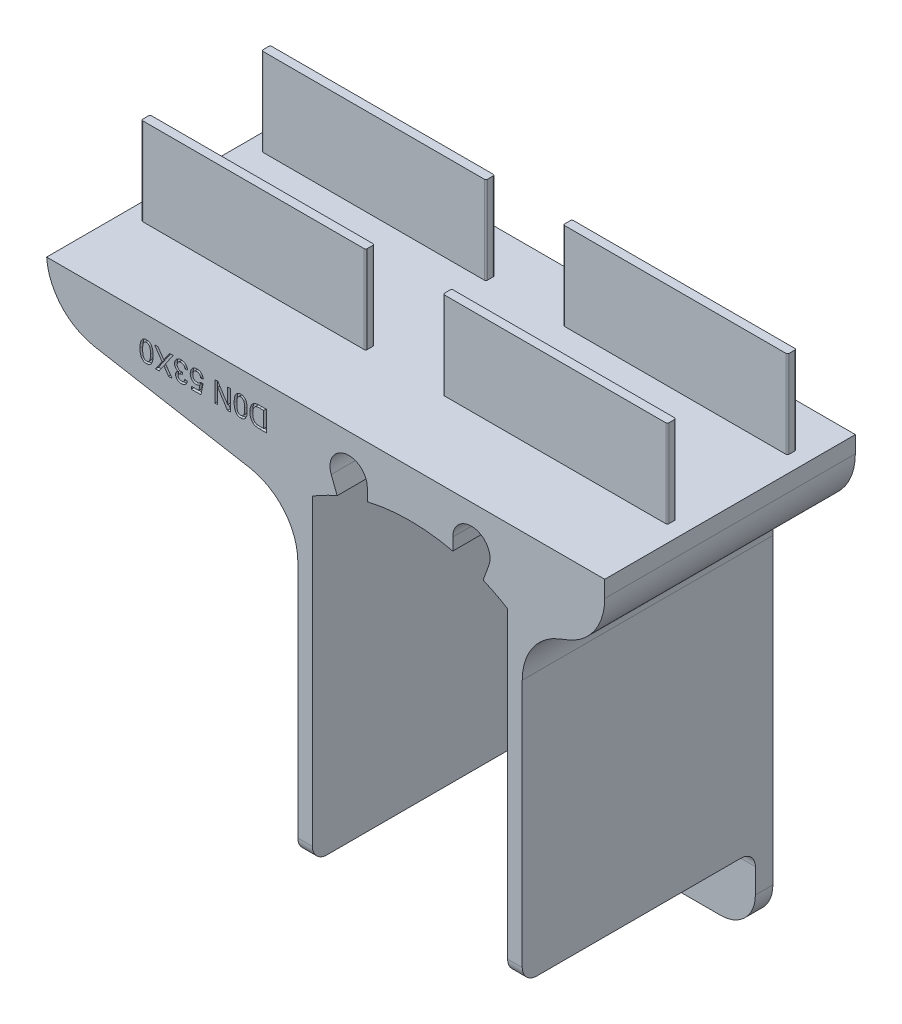
from build123d import *

# Parameters (mm, degrees)
SALIENTE_EXTRUIR1_DEPTH = 3
SALIENTE_EXTRUIR2_DEPTH = 40
SALIENTE_EXTRUIR3_START = -30.259494
SALIENTE_EXTRUIR3_DEPTH = 43
REDONDEO1_R             = 10
SALIENTE_EXTRUIR4_DEPTH = 15
CROQUIS12_R             = 1.6
CORTAR_EXTRUIR2_DEPTH   = 3
CORTAR_EXTRUIR3_START   = -3
CROQUIS13_R             = 3.2
CORTAR_EXTRUIR3_DEPTH   = 161.915601565
CORTAR_EXTRUIR4_START   = -40
CORTAR_EXTRUIR4_DEPTH   = 40
CROQUIS15_W             = 5
CROQUIS15_H             = 12.88583411
CORTAR_EXTRUIR5_DEPTH   = 10
REDONDEO2_R             = 2.5
REDONDEO2_R_2           = 1
CORTAR_EXTRUIR7_DEPTH   = 0.5


with BuildPart() as part:
    # Croquis4 → Saliente-Extruir1 (new body)
    with BuildSketch(Plane.XY):
        with BuildLine():
            Line((-61.92533433, -22.513800254), (-61.92533433, 45.486199746))
            ThreePointArc((-61.92533433, 45.486199746), (-63.682693643, 49.728840433), (-67.92533433, 51.486199746))
            Line((-67.92533433, 51.486199746), (-94.42533433, 51.486199746))
            ThreePointArc((-94.42533433, 51.486199746), (-98.667975017, 49.728840433), (-100.42533433, 45.486199746))
            Line((-100.42533433, 45.486199746), (-100.42533433, -22.513800254))
            ThreePointArc((-100.42533433, -22.513800254), (-98.667975017, -26.756440941), (-94.42533433, -28.513800254))
            Line((-94.42533433, -28.513800254), (-67.92533433, -28.513800254))
            ThreePointArc((-67.92533433, -28.513800254), (-63.682693643, -26.756440941), (-61.92533433, -22.513800254))
        make_face()
        with BuildLine():
            Line((-64.42533433, -15.795468477), (-64.42533433, 38.767867969))
            ThreePointArc((-64.42533433, 38.767867969), (-81.17533433, 43.486199746), (-97.92533433, 38.767867969))
            Line((-97.92533433, 38.767867969), (-97.92533433, -15.795468477))
            ThreePointArc((-97.92533433, -15.795468477), (-81.17533433, -20.513800254), (-64.42533433, -15.795468477))
        make_face(mode=Mode.SUBTRACT)
    extrude(amount=SALIENTE_EXTRUIR1_DEPTH)

    # Croquis5 → Saliente-Extruir2 (add)
    with BuildSketch(Plane.XY.offset(3)):
        with BuildLine():
            Line((-64.42533433, -15.795468477), (-64.42533433, 38.767867969))
            ThreePointArc((-64.42533433, 38.767867969), (-81.17533433, 43.486199746), (-97.92533433, 38.767867969))
            Line((-97.92533433, 38.767867969), (-97.92533433, -15.795468477))
            Line((-97.92533433, -15.795468477), (-100.42533433, -15.795468477))
            Line((-100.42533433, -15.795468477), (-100.42533433, 40.134829685))
            ThreePointArc((-100.42533433, 40.134829685), (-81.17533433, 45.986199746), (-61.92533433, 40.134829685))
            Line((-61.92533433, 40.134829685), (-61.92533433, -15.795468477))
            Line((-61.92533433, -15.795468477), (-64.42533433, -15.795468477))
        make_face()
    extrude(amount=SALIENTE_EXTRUIR2_DEPTH)

    # Croquis7 → Saliente-Extruir3 (add)
    with BuildSketch(Plane.XY.offset(30.259493934).offset(SALIENTE_EXTRUIR3_START)):
        with BuildLine():
            Line((-143.523202583, 51.486199746), (-143.523202583, 43.741183456))
            Line((-143.523202583, 43.741183456), (-100.42533433, 36.141866472))
            Line((-100.42533433, 36.141866472), (-100.42533433, 40.134829685))
            ThreePointArc((-100.42533433, 40.134829685), (-81.17533433, 45.986199746), (-61.92533433, 40.134829685))
            Line((-61.92533433, 40.134829685), (-61.92533433, 36.141866472))
            Line((-61.92533433, 36.141866472), (-47.771305799, 41.892946561))
            Line((-47.771305799, 41.892946561), (-47.771305799, 51.486199746))
            Line((-47.771305799, 51.486199746), (-143.523202583, 51.486199746))
        make_face()
    extrude(amount=SALIENTE_EXTRUIR3_DEPTH)

    # Redondeo1
    # the kernel refuses this fillet: 10 mm, written as the material it adds along each edge
    with BuildSketch(Plane(origin=(-61.92533433, 36.141866472, -6.6e-08), x_dir=(0, -1, 0), z_dir=(0, 0, 1))) as redondeo1_piece_1:
        with BuildLine():
            CenterArc((REDONDEO1_R * 0.673075430439, REDONDEO1_R), REDONDEO1_R, 202.112943676, 67.887056324)
            Line((-REDONDEO1_R * 0.253368184059, REDONDEO1_R * 0.623566434606), (0, 0))
            Line((0, 0), (REDONDEO1_R * 0.673075430439, 0))
        make_face()
    extrude(amount=43)
    with BuildSketch(Plane(origin=(-100.42533433, 36.141866472, -6.6e-08), x_dir=(0, -1, 0), z_dir=(0, 0, 1))) as redondeo1_piece_2:
        with BuildLine():
            CenterArc((REDONDEO1_R * 0.839099631177, -REDONDEO1_R), REDONDEO1_R, 90, 80)
            Line((-REDONDEO1_R * 0.145708121835, -REDONDEO1_R * 0.826351822333), (0, 0))
            Line((0, 0), (REDONDEO1_R * 0.839099631177, 0))
        make_face()
    extrude(amount=43)
    # the kernel refuses this fillet: 10 mm, written as the material it takes off along each edge
    with BuildSketch(Plane(origin=(-47.771305799, 41.892946561, -16.826885827), x_dir=(-0.9264436144982273, -0.3764335653942936, 0), z_dir=(0, 0, 1))) as redondeo1_2_piece_1:
        with BuildLine():
            CenterArc((REDONDEO1_R * 0.673075430439, -REDONDEO1_R), REDONDEO1_R, 90, 67.887056324)
            Line((-REDONDEO1_R * 0.253368184059, -REDONDEO1_R * 0.623566434606), (0, 0))
            Line((0, 0), (REDONDEO1_R * 0.673075430439, 0))
        make_face()
    extrude(amount=76.653771522, mode=Mode.SUBTRACT)
    with BuildSketch(Plane(origin=(-143.523202583, 43.741183456, -20.923855552), x_dir=(0, 1, 0), z_dir=(0, 0, 1))) as redondeo1_2_piece_2:
        with BuildLine():
            CenterArc((8.39472178, -9.978871819), REDONDEO1_R, 93.72516215, 76.27483785)
            Line((-1.45335575, -8.242390042), (0, 0))
            Line((0, 0), (7.74501629, 0))
        make_face()
    extrude(amount=84.847710972, mode=Mode.SUBTRACT)

    # Croquis8 → Saliente-Extruir4 (add)
    with BuildSketch(Plane(origin=(0, 51.486199746, 0), x_dir=(1, 0, 0), z_dir=(0, 1, 0))):
        with BuildLine():
            Line((-88.771305799, -7.384493934), (-50.771305799, -7.384493934))
            ThreePointArc((-50.771305799, -7.384493934), (-50.594529104, -7.457717239), (-50.521305799, -7.634493934))
            Line((-50.521305799, -7.634493934), (-50.521305799, -8.634493934))
            ThreePointArc((-50.521305799, -8.634493934), (-50.594529104, -8.811270629), (-50.771305799, -8.884493934))
            Line((-50.771305799, -8.884493934), (-88.771305799, -8.884493934))
            ThreePointArc((-88.771305799, -8.884493934), (-88.948082494, -8.811270629), (-89.021305799, -8.634493934))
            Line((-89.021305799, -8.634493934), (-89.021305799, -7.634493934))
            ThreePointArc((-89.021305799, -7.634493934), (-88.948082494, -7.457717239), (-88.771305799, -7.384493934))
        make_face()
        with BuildLine():
            Line((-88.771305799, -28.009493934), (-50.771305799, -28.009493934))
            ThreePointArc((-50.771305799, -28.009493934), (-50.594529104, -28.082717239), (-50.521305799, -28.259493934))
            Line((-50.521305799, -28.259493934), (-50.521305799, -29.259493934))
            ThreePointArc((-50.521305799, -29.259493934), (-50.594529104, -29.436270629), (-50.771305799, -29.509493934))
            Line((-50.771305799, -29.509493934), (-88.771305799, -29.509493934))
            ThreePointArc((-88.771305799, -29.509493934), (-88.948082494, -29.436270629), (-89.021305799, -29.259493934))
            Line((-89.021305799, -29.259493934), (-89.021305799, -28.259493934))
            ThreePointArc((-89.021305799, -28.259493934), (-88.948082494, -28.082717239), (-88.771305799, -28.009493934))
        make_face()
        with BuildLine():
            Line((-140.523202583, -28.009493934), (-102.523202583, -28.009493934))
            ThreePointArc((-102.523202583, -28.009493934), (-102.346425888, -28.082717239), (-102.273202583, -28.259493934))
            Line((-102.273202583, -28.259493934), (-102.273202583, -29.259493934))
            ThreePointArc((-102.273202583, -29.259493934), (-102.346425888, -29.436270629), (-102.523202583, -29.509493934))
            Line((-102.523202583, -29.509493934), (-140.523202583, -29.509493934))
            ThreePointArc((-140.523202583, -29.509493934), (-140.699979279, -29.436270629), (-140.773202583, -29.259493934))
            Line((-140.773202583, -29.259493934), (-140.773202583, -28.259493934))
            ThreePointArc((-140.773202583, -28.259493934), (-140.699979279, -28.082717239), (-140.523202583, -28.009493934))
        make_face()
        with BuildLine():
            Line((-140.523202583, -7.384493934), (-102.523202583, -7.384493934))
            ThreePointArc((-102.523202583, -7.384493934), (-102.346425888, -7.457717239), (-102.273202583, -7.634493934))
            Line((-102.273202583, -7.634493934), (-102.273202583, -8.634493934))
            ThreePointArc((-102.273202583, -8.634493934), (-102.346425888, -8.811270629), (-102.523202583, -8.884493934))
            Line((-102.523202583, -8.884493934), (-140.523202583, -8.884493934))
            ThreePointArc((-140.523202583, -8.884493934), (-140.699979279, -8.811270629), (-140.773202583, -8.634493934))
            Line((-140.773202583, -8.634493934), (-140.773202583, -7.634493934))
            ThreePointArc((-140.773202583, -7.634493934), (-140.699979279, -7.457717239), (-140.523202583, -7.384493934))
        make_face()
    extrude(amount=SALIENTE_EXTRUIR4_DEPTH)

    # Croquis12 → Cortar-Extruir2 (cut)
    with BuildSketch(Plane(origin=(0, 0, 0), x_dir=(-1, 0, 0), z_dir=(0, 0, -1))):
        with Locations((91.70533433, 44.736199746)):
            Circle(CROQUIS12_R)
        with Locations((70.64533433, 44.736199746)):
            Circle(CROQUIS12_R)
        with Locations((91.70533433, -21.763800254)):
            Circle(CROQUIS12_R)
        with Locations((70.64533433, -21.763800254)):
            Circle(CROQUIS12_R)
    extrude(amount=-CORTAR_EXTRUIR2_DEPTH, mode=Mode.SUBTRACT)

    # Croquis13 → Cortar-Extruir3 (cut, through all)
    with BuildSketch(Plane(origin=(0, 0, 0), x_dir=(-1, 0, 0), z_dir=(0, 0, -1)).offset(CORTAR_EXTRUIR3_START)):
        with Locations((70.64533433, 44.736199746)):
            Circle(CROQUIS13_R)
        with Locations((91.70533433, 44.736199746)):
            Circle(CROQUIS13_R)
    extrude(amount=-CORTAR_EXTRUIR3_DEPTH, mode=Mode.SUBTRACT)

    # Croquis14 → Cortar-Extruir4 (cut)
    with BuildSketch(Plane.XY.offset(43).offset(CORTAR_EXTRUIR4_START)):
        with BuildLine():
            Line((-94.696098231, 43.598073527), (-92.27582923, 37.238099531))
            Line((-92.27582923, 37.238099531), (-88.50533433, 37.238099531))
            Line((-88.50533433, 37.238099531), (-88.50533433, 44.736199746))
            ThreePointArc((-88.50533433, 44.736199746), (-92.283934156, 47.88345605), (-94.696098231, 43.598073527))
        make_face()
        with BuildLine():
            Line((-73.84533433, 44.736199746), (-73.84533433, 37.238099531))
            Line((-73.84533433, 37.238099531), (-69.986177524, 37.238099531))
            Line((-69.986177524, 37.238099531), (-67.6409103, 43.634638922))
            ThreePointArc((-67.6409103, 43.634638922), (-70.085940415, 47.8869264), (-73.84533433, 44.736199746))
        make_face()
    extrude(amount=CORTAR_EXTRUIR4_DEPTH, mode=Mode.SUBTRACT)

    # Croquis15 → Cortar-Extruir5 (cut)
    with BuildSketch(Plane.XY.offset(3)):
        with Locations((-81.17533433, -24.254653433)):
            Rectangle(CROQUIS15_W, CROQUIS15_H)
    extrude(amount=-CORTAR_EXTRUIR5_DEPTH, mode=Mode.SUBTRACT)

    # Redondeo2
    # the kernel refuses this fillet: 2.5, 1 mm, written as the material it adds along each edge
    with BuildSketch(Plane(origin=(-61.92533433, -15.795468477, 3), x_dir=(0, 0, 1), z_dir=(-1, 0, 0))) as redondeo2_piece_1_section:
        with BuildLine():
            CenterArc((REDONDEO2_R, -REDONDEO2_R), REDONDEO2_R, 90, 90)
            Line((0, -REDONDEO2_R), (0, 0))
            Line((0, 0), (REDONDEO2_R, 0))
        make_face()
    redondeo2_piece_1 = extrude(amount=2.5, mode=Mode.PRIVATE)
    redondeo2_piece_1 = redondeo2_piece_1 - Plane(origin=(-81.17533433, 11.576477524, 3), x_dir=(-0.5219649426531061, -0.8529669387737955, 0), z_dir=(0, 0, -1)) * Cylinder(32.090277778, 16, mode=Mode.PRIVATE)
    add(redondeo2_piece_1)
    with BuildSketch(Plane(origin=(-61.92533433, -15.795468477, 3), x_dir=(0, 0, 1), z_dir=(-1, 0, 0))) as redondeo2_piece_2_section:
        with BuildLine():
            CenterArc((REDONDEO2_R, -REDONDEO2_R), REDONDEO2_R, 90, 90)
            Line((0, -REDONDEO2_R), (0, 0))
            Line((0, 0), (REDONDEO2_R, 0))
        make_face()
    redondeo2_piece_2 = extrude(amount=8.75, mode=Mode.PRIVATE)
    redondeo2_piece_2 = split(redondeo2_piece_2, bisect_by=Plane(origin=(-64.42533433, -15.795468477, 3), z_dir=(-1, 0, 0)), keep=Keep.TOP, mode=Mode.PRIVATE)
    redondeo2_piece_2 = redondeo2_piece_2 - Plane(origin=(-81.17533433, 11.576477524, 3), x_dir=(-0.5219649426531061, -0.8529669387737955, 0), z_dir=(0, 0, -1)) * Cylinder(32.090277778, 28, mode=Mode.PRIVATE)
    add(redondeo2_piece_2)
    with BuildSketch(Plane(origin=(-91.67533433, -15.795468477, 3), x_dir=(0, -1, 0), z_dir=(-1, 0, 0))) as redondeo2_piece_3_section:
        with BuildLine():
            CenterArc((REDONDEO2_R, REDONDEO2_R), REDONDEO2_R, 180, 90)
            Line((0, REDONDEO2_R), (0, 0))
            Line((0, 0), (REDONDEO2_R, 0))
        make_face()
    redondeo2_piece_3 = extrude(amount=8.75, mode=Mode.PRIVATE)
    redondeo2_piece_3 = redondeo2_piece_3 - Plane(origin=(-81.17533433, 11.576477524, 3), x_dir=(-0.5219649426531061, -0.8529669387737955, 0), z_dir=(0, 0, -1)) * Cylinder(32.090277778, 28, mode=Mode.PRIVATE)
    redondeo2_piece_3 = split(redondeo2_piece_3, bisect_by=Plane(origin=(-97.92533433, -15.795468477, 3), z_dir=(1, 0, 0)), keep=Keep.TOP, mode=Mode.PRIVATE)
    add(redondeo2_piece_3)
    with BuildSketch(Plane(origin=(-97.92533433, -15.795468477, 3), x_dir=(0, -1, 0), z_dir=(-1, 0, 0))) as redondeo2_piece_4_section:
        with BuildLine():
            CenterArc((REDONDEO2_R, REDONDEO2_R), REDONDEO2_R, 180, 90)
            Line((0, REDONDEO2_R), (0, 0))
            Line((0, 0), (REDONDEO2_R, 0))
        make_face()
    redondeo2_piece_4 = extrude(amount=2.5, mode=Mode.PRIVATE)
    redondeo2_piece_4 = redondeo2_piece_4 - Plane(origin=(-81.17533433, 11.576477524, 3), x_dir=(-0.5219649426531061, -0.8529669387737955, 0), z_dir=(0, 0, -1)) * Cylinder(32.090277778, 15, mode=Mode.PRIVATE)
    add(redondeo2_piece_4)
    # the kernel refuses this fillet: 2.5, 1 mm, written as the material it takes off along each edge
    with BuildSketch(Plane(origin=(-83.67533433, -20.416270527, 5.279773555), x_dir=(-0.9957731104798505, 0.09184722339452334, 0), z_dir=(0, 0, -1))) as redondeo2_2_piece_1:
        with BuildLine():
            CenterArc((0.912016762, -0.999902105), REDONDEO2_R_2, 90.801717876, 83.928396695)
            Line((-0.083756348, -0.908054882), (0, 0))
            ThreePointArc((0, 0), (0.449012301, -0.00314148), (0.898024602, 0))
        make_face()
    extrude(amount=7.55954711, mode=Mode.SUBTRACT)
    with BuildSketch(Plane(origin=(-78.67533433, -20.416270527, 5.279773555), x_dir=(0.9957731104798505, 0.09184722339452334, 0), z_dir=(0, 0, -1))) as redondeo2_2_piece_2:
        with BuildLine():
            CenterArc((0.912016762, 0.999902105), REDONDEO2_R_2, 185.269885429, 83.928396695)
            Line((-0.083756348, 0.908054882), (0, 0))
            ThreePointArc((0, 0), (0.449012301, 0.00314148), (0.898024602, 0))
        make_face()
    extrude(amount=7.55954711, mode=Mode.SUBTRACT)
    with BuildSketch(Plane(origin=(-78.67533433, -28.513800254, -2.5), x_dir=(0, 1, 0), z_dir=(0, 0, 1)), Plane(origin=(-83.67533433, -28.513800254, 5.5), x_dir=(0, 1, 0), z_dir=(0, 0, -1))) as redondeo2_2_piece_3:
        with BuildLine():
            CenterArc((REDONDEO2_R_2, -REDONDEO2_R_2), REDONDEO2_R_2, 90, 90)
            Line((0, -REDONDEO2_R_2), (0, 0))
            Line((0, 0), (REDONDEO2_R_2, 0))
        make_face()
    extrude(amount=8, mode=Mode.SUBTRACT)
    with BuildSketch(Plane(origin=(-55.675334165, -15.795468477, 43), x_dir=(0, 0.9999999999999997, -2.646320069743527e-08), z_dir=(-1, 0, 0)), Plane(origin=(-91.675334165, -15.795468477, 43), x_dir=(1.4210854715201999e-15, 0.9999999999999997, -2.646320069743523e-08), z_dir=(-1, 0, 0))) as redondeo2_2_piece_4:
        with BuildLine():
            CenterArc((REDONDEO2_R * 1.00000002646, REDONDEO2_R), REDONDEO2_R, 179.999998484, 90)
            Line((REDONDEO2_R * 2.64631999767e-08, REDONDEO2_R * 1.00000002646), (0, 0))
            Line((0, 0), (REDONDEO2_R, 0))
        make_face()
    extrude(amount=15.000000331, mode=Mode.SUBTRACT)

    # Croquis18 → Cortar-Extruir7 (cut)
    # profile 1 of 7: a face of its own
    with BuildSketch(Plane.XY.offset(43)):
        with BuildLine():
            Line((-105.784803515, 47.713694789), (-105.784803515, 44.213694789))
            Line((-105.784803515, 44.213694789), (-106.981618419, 44.213694789))
            add(Edge.make_bspline(
                [(-106.981618419, 44.213694789), (-107.014341398, 44.213727734), (-107.077930846, 44.213791756), (-107.17022759, 44.217188253), (-107.25653495, 44.220013079), (-107.336679935, 44.226011278), (-107.411115983, 44.232491305), (-107.479488386, 44.242122645), (-107.542155858, 44.251118895), (-107.581355436, 44.259965881), (-107.600007842, 44.264175558)],
                knots=[0, 0, 0, 0, 1.263205393, 2.454743942, 3.565448358, 4.596561792, 5.557210882, 6.449177921, 7.26206951, 8, 8, 8, 8], degree=3))
            add(Edge.make_bspline(
                [(-107.600007842, 44.264175558), (-107.648298935, 44.276796855), (-107.742962558, 44.301538015), (-107.876555719, 44.358070089), (-107.999781716, 44.427647708), (-108.072785135, 44.48567346), (-108.109022265, 44.514476039)],
                knots=[0, 0, 0, 0, 1.044851836, 2.048192626, 3.031170054, 4, 4, 4, 4], degree=3))
            add(Edge.make_bspline(
                [(-108.109022265, 44.514476039), (-108.131534429, 44.534245268), (-108.176660659, 44.573873214), (-108.238639918, 44.639163834), (-108.296142433, 44.708423851), (-108.350859503, 44.780473683), (-108.399389282, 44.857891187), (-108.444634947, 44.938719297), (-108.485197748, 45.023792528), (-108.521792095, 45.112640446), (-108.552904392, 45.20563843), (-108.581287309, 45.301341755), (-108.604285594, 45.400674868), (-108.622946053, 45.503212076), (-108.638755231, 45.6088313), (-108.648899093, 45.717908421), (-108.65545056, 45.830166478), (-108.656212052, 45.906193196), (-108.656598387, 45.944764501)],
                knots=[0, 0, 0, 0, 0.908937239, 1.821988899, 2.72834861, 3.640518201, 4.565341062, 5.498854507, 6.450621543, 7.424027163, 8.413224035, 9.425546677, 10.452695354, 11.505842725, 12.58820393, 13.692765598, 14.829450422, 16, 16, 16, 16], degree=3))
            add(Edge.make_bspline(
                [(-108.656598387, 45.944764501), (-108.655653967, 46.009312481), (-108.653816147, 46.134921329), (-108.635803453, 46.317397559), (-108.607659327, 46.488873121), (-108.56694964, 46.648360355), (-108.516864298, 46.795584824), (-108.461391365, 46.930418556), (-108.398999789, 47.051865504), (-108.329860947, 47.159652428), (-108.255898082, 47.25560093), (-108.177944717, 47.340415395), (-108.097396377, 47.41553467), (-108.011700212, 47.479691625), (-107.920016633, 47.534890651), (-107.820654381, 47.582967933), (-107.711857742, 47.622360575), (-107.594655711, 47.656374475), (-107.467945471, 47.681771707), (-107.332649567, 47.70064332), (-107.188409771, 47.711979077), (-107.089378217, 47.713111804), (-107.038409284, 47.713694789)],
                knots=[0, 0, 0, 0, 1.410896996, 2.745572339, 4.004803626, 5.206943026, 6.339671611, 7.40250992, 8.392084316, 9.320508322, 10.198457542, 11.037492232, 11.836665538, 12.603135473, 13.373428224, 14.173319976, 15.012401344, 15.900286915, 16.839281235, 17.835076164, 18.88577074, 20, 20, 20, 20], degree=3))
            Line((-107.038409284, 47.713694789), (-105.784803515, 47.713694789))
        make_face()
        with BuildLine():
            Line((-106.278393259, 47.309848635), (-106.999847586, 47.309848635))
            add(Edge.make_bspline(
                [(-106.999847586, 47.309848635), (-107.052456733, 47.309070328), (-107.151981517, 47.307597945), (-107.292357447, 47.296041518), (-107.415059307, 47.276657682), (-107.520853505, 47.247443062), (-107.612663576, 47.211421084), (-107.693667809, 47.168771113), (-107.765953361, 47.120584751), (-107.806646166, 47.081428234), (-107.826470182, 47.062352642)],
                knots=[0, 0, 0, 0, 1.42394665, 2.693789808, 3.809767978, 4.781339506, 5.658909862, 6.473911632, 7.256546726, 8, 8, 8, 8], degree=3))
            add(Edge.make_bspline(
                [(-107.826470182, 47.062352642), (-107.852287638, 47.032827464), (-107.905325572, 46.972172594), (-107.971433502, 46.866234327), (-108.028942637, 46.746664833), (-108.077988834, 46.613199227), (-108.116446607, 46.465057237), (-108.143031465, 46.302180735), (-108.160161213, 46.124616552), (-108.162035864, 46.001130563), (-108.163008643, 45.937052161)],
                knots=[0, 0, 0, 0, 0.782156772, 1.606819028, 2.48344231, 3.428394571, 4.441474292, 5.534758072, 6.720755568, 8, 8, 8, 8], degree=3))
            add(Edge.make_bspline(
                [(-108.163008643, 45.937052161), (-108.162523179, 45.892397836), (-108.161579294, 45.805576735), (-108.152773799, 45.679272989), (-108.140010043, 45.560775515), (-108.121062086, 45.450252351), (-108.096902076, 45.347759215), (-108.066526738, 45.253432255), (-108.031776248, 45.16663326), (-107.99106909, 45.087924738), (-107.945450378, 45.017061708), (-107.898776242, 44.951698772), (-107.849677655, 44.892297093), (-107.797450248, 44.839721115), (-107.743609009, 44.792451859), (-107.687164257, 44.751448078), (-107.628270367, 44.716724676), (-107.586886131, 44.698699429), (-107.566353996, 44.689756488)],
                knots=[0, 0, 0, 0, 1.460175233, 2.839008838, 4.138850805, 5.35645207, 6.503979257, 7.579611513, 8.594434352, 9.558450226, 10.472350594, 11.34842506, 12.184161516, 12.989461046, 13.769593904, 14.524843114, 15.268124212, 16, 16, 16, 16], degree=3))
            add(Edge.make_bspline(
                [(-107.566353996, 44.689756488), (-107.550310994, 44.683885443), (-107.516316924, 44.671445084), (-107.460835306, 44.657364468), (-107.398917258, 44.644406401), (-107.329952478, 44.635311528), (-107.254289751, 44.626472303), (-107.171458762, 44.62110089), (-107.081893922, 44.618666706), (-107.019947662, 44.617924552), (-106.987928515, 44.617540943)],
                knots=[0, 0, 0, 0, 0.699400087, 1.48198292, 2.341906832, 3.289648813, 4.329964754, 5.462247508, 6.688271602, 8, 8, 8, 8], degree=3))
            Line((-106.987928515, 44.617540943), (-106.278393259, 44.617540943))
            Line((-106.278393259, 44.617540943), (-106.278393259, 47.309848635))
        make_face(mode=Mode.SUBTRACT)
    # profile 2 of 7: a face of its own
    with BuildSketch(Plane.XY.offset(43)):
        with BuildLine():
            add(Edge.make_bspline(
                [(-109.105316336, 45.98753293), (-109.105768542, 45.937514742), (-109.106654223, 45.839550173), (-109.112144613, 45.696210007), (-109.121739402, 45.560087282), (-109.136032, 45.431293459), (-109.153085573, 45.309333768), (-109.174931923, 45.194533232), (-109.19986217, 45.086762886), (-109.229412828, 44.986431754), (-109.262427474, 44.892498851), (-109.299256499, 44.804699821), (-109.34119582, 44.723483135), (-109.384704563, 44.646915351), (-109.434206704, 44.577934344), (-109.486225384, 44.514034652), (-109.542344607, 44.456326172), (-109.602805051, 44.405088048), (-109.667138018, 44.359852877), (-109.735140951, 44.320593525), (-109.807304072, 44.287153972), (-109.883830925, 44.260956326), (-109.963976632, 44.239870722), (-110.048058341, 44.224283448), (-110.136225951, 44.215112489), (-110.196473877, 44.214172695), (-110.227111208, 44.213694789)],
                knots=[0, 0, 0, 0, 1.514548985, 2.966363668, 4.342801279, 5.645536807, 6.88951609, 8.070636169, 9.18292944, 10.237633186, 11.23586543, 12.196673567, 13.117642805, 14.002448775, 14.860474521, 15.685016546, 16.495716207, 17.293997176, 18.081286888, 18.873901753, 19.668661895, 20.485546082, 21.319749152, 22.176139114, 23.072528574, 24, 24, 24, 24], degree=3))
            add(Edge.make_bspline(
                [(-110.227111208, 44.213694789), (-110.272066202, 44.21499561), (-110.360382091, 44.217551126), (-110.489160358, 44.239006405), (-110.610900055, 44.274133157), (-110.724678067, 44.32301782), (-110.828995887, 44.385641309), (-110.922547549, 44.460892633), (-111.00307354, 44.549893441), (-111.072164986, 44.65082528), (-111.13146323, 44.763657427), (-111.18449245, 44.887422241), (-111.232042629, 45.022616967), (-111.266846171, 45.143293998), (-111.291246787, 45.247642774), (-111.306102533, 45.333869476), (-111.319818702, 45.426622922), (-111.329540908, 45.526125254), (-111.339434043, 45.631911414), (-111.344318404, 45.744442679), (-111.348045892, 45.863642634), (-111.348613975, 45.945461983), (-111.348906079, 45.98753293)],
                knots=[0, 0, 0, 0, 1.134392726, 2.228560011, 3.285421824, 4.326686528, 5.345663051, 6.348245061, 7.346442277, 8.364444627, 9.428234171, 10.559369172, 11.76117748, 13.044149777, 13.72830454, 14.465558531, 15.252424724, 16.094928615, 16.989169351, 17.934396366, 18.93788079, 20, 20, 20, 20], degree=3))
            add(Edge.make_bspline(
                [(-111.348906079, 45.98753293), (-111.34844804, 46.037316585), (-111.34755317, 46.134578753), (-111.342173334, 46.276763896), (-111.332129614, 46.411879623), (-111.31919541, 46.540093047), (-111.30175098, 46.661514935), (-111.280091952, 46.775652664), (-111.25474915, 46.882778457), (-111.226252126, 46.983322655), (-111.193376587, 47.077506696), (-111.156125098, 47.165210823), (-111.115458045, 47.247114191), (-111.070681185, 47.322801172), (-111.022025831, 47.392521791), (-110.970277811, 47.456739968), (-110.913998353, 47.514562996), (-110.853301357, 47.565697442), (-110.789406567, 47.611767067), (-110.721030651, 47.651176676), (-110.648332397, 47.684054049), (-110.571960041, 47.711532622), (-110.491406574, 47.732415764), (-110.407091741, 47.747920942), (-110.318465461, 47.757182004), (-110.257982764, 47.75809869), (-110.227111208, 47.758566584)],
                knots=[0, 0, 0, 0, 1.508950488, 2.948031798, 4.311688408, 5.614950163, 6.853137481, 8.028455569, 9.134944892, 10.188708076, 11.194600246, 12.156350049, 13.075032267, 13.964295672, 14.819092354, 15.649926205, 16.461420415, 17.260483761, 18.05264124, 18.846032929, 19.648010917, 20.468054852, 21.303075505, 22.167271292, 23.064539283, 24, 24, 24, 24], degree=3))
            add(Edge.make_bspline(
                [(-110.227111208, 47.758566584), (-110.186635926, 47.757412025), (-110.107720268, 47.755160951), (-109.992469768, 47.739866295), (-109.884301027, 47.712946981), (-109.782301703, 47.676844385), (-109.687618295, 47.628555085), (-109.59979873, 47.569801721), (-109.517078335, 47.501951253), (-109.469459447, 47.448418792), (-109.445360406, 47.421327001)],
                knots=[0, 0, 0, 0, 1.10322584, 2.150986741, 3.161425019, 4.136713905, 5.093944212, 6.049774532, 7.013026876, 8, 8, 8, 8], degree=3))
            add(Edge.make_bspline(
                [(-109.445360406, 47.421327001), (-109.417621856, 47.381313735), (-109.360423778, 47.298804669), (-109.293478388, 47.158119057), (-109.233761914, 47.003243952), (-109.186895431, 46.831140721), (-109.150187292, 46.643179112), (-109.123674851, 46.438990304), (-109.108671419, 46.218662513), (-109.106459943, 46.066315329), (-109.105316336, 45.98753293)],
                knots=[0, 0, 0, 0, 0.779365345, 1.607084704, 2.489375761, 3.438383567, 4.461919411, 5.557722155, 6.737039282, 8, 8, 8, 8], degree=3))
        make_face()
        with BuildLine():
            add(Edge.make_bspline(
                [(-109.554034284, 45.986130687), (-109.554479826, 46.053448417), (-109.55533269, 46.182309443), (-109.564243054, 46.36640965), (-109.579581878, 46.532493168), (-109.599860806, 46.680330041), (-109.626637201, 46.810120249), (-109.660258132, 46.921533045), (-109.698156917, 47.015905638), (-109.745055946, 47.092068349), (-109.796405203, 47.15415207), (-109.849419802, 47.207546078), (-109.905346992, 47.252929762), (-109.963821856, 47.290770498), (-110.025751673, 47.319421018), (-110.090459251, 47.340186979), (-110.15795867, 47.35213747), (-110.203928841, 47.353854531), (-110.227111208, 47.35472043)],
                knots=[0, 0, 0, 0, 1.89448813, 3.626469325, 5.185477471, 6.587276848, 7.82441448, 8.910550357, 9.859733512, 10.6775885, 11.416198291, 12.123144072, 12.791880183, 13.439617036, 14.078171869, 14.70637855, 15.347637704, 16, 16, 16, 16], degree=3))
            add(Edge.make_bspline(
                [(-110.227111208, 47.35472043), (-110.250287957, 47.353835839), (-110.296246989, 47.352081712), (-110.36389963, 47.340391416), (-110.428365698, 47.318568872), (-110.490164399, 47.289972511), (-110.549338406, 47.253095667), (-110.604499271, 47.206708762), (-110.658108086, 47.153476857), (-110.708909847, 47.090684025), (-110.756118449, 47.014548367), (-110.793945639, 46.920115836), (-110.827596883, 46.808723659), (-110.854285708, 46.679149322), (-110.874708862, 46.531568463), (-110.889935822, 46.365938554), (-110.898911676, 46.182077378), (-110.8997496, 46.053448887), (-110.900188131, 45.986130687)],
                knots=[0, 0, 0, 0, 0.652578524, 1.294050225, 1.924494109, 2.563260593, 3.207694917, 3.880813851, 4.587993952, 5.331957758, 6.150083828, 7.099581593, 8.186077474, 9.42362516, 10.819375359, 12.378900244, 14.104883934, 16, 16, 16, 16], degree=3))
            add(Edge.make_bspline(
                [(-110.900188131, 45.986130687), (-110.899763208, 45.920213318), (-110.898949072, 45.793918133), (-110.889747659, 45.613364692), (-110.875328561, 45.450068586), (-110.855604464, 45.303880553), (-110.829394475, 45.174955234), (-110.797595254, 45.063030846), (-110.759732593, 44.968307017), (-110.714618959, 44.88995289), (-110.664598414, 44.825274148), (-110.611452864, 44.770380866), (-110.556210792, 44.722276042), (-110.49571534, 44.684608974), (-110.432538262, 44.653716544), (-110.365325242, 44.633036148), (-110.294944142, 44.619763628), (-110.246804923, 44.618292674), (-110.222203355, 44.617540943)],
                knots=[0, 0, 0, 0, 1.850145643, 3.544809038, 5.072983816, 6.450691362, 7.683229814, 8.76276662, 9.712991103, 10.538891656, 11.292051756, 12.001912283, 12.681449089, 13.342071824, 13.996410874, 14.649960216, 15.310061595, 16, 16, 16, 16], degree=3))
            add(Edge.make_bspline(
                [(-110.222203355, 44.617540943), (-110.199019459, 44.618143016), (-110.153303788, 44.619330228), (-110.086421522, 44.630872276), (-110.022749406, 44.649714227), (-109.96271118, 44.67689428), (-109.905712561, 44.710613806), (-109.851684386, 44.751626892), (-109.801922037, 44.801195624), (-109.771973617, 44.838333097), (-109.756658483, 44.857324597)],
                knots=[0, 0, 0, 0, 1.021462953, 2.014194051, 2.982449609, 3.941891643, 4.91211921, 5.897280499, 6.924703483, 8, 8, 8, 8], degree=3))
            add(Edge.make_bspline(
                [(-109.756658483, 44.857324597), (-109.739980272, 44.885207529), (-109.704759402, 44.94409041), (-109.665363976, 45.046434458), (-109.63042808, 45.163598217), (-109.602053237, 45.297026991), (-109.581057126, 45.446537538), (-109.564795755, 45.61189141), (-109.556266876, 45.793700551), (-109.554799014, 45.920217572), (-109.554034284, 45.986130687)],
                knots=[0, 0, 0, 0, 0.671109831, 1.417242661, 2.260125669, 3.199948126, 4.23589883, 5.382398214, 6.636276086, 8, 8, 8, 8], degree=3))
        make_face(mode=Mode.SUBTRACT)
    # profile 3 of 7: a face of its own
    with BuildSketch(Plane.XY.offset(43)):
        Polygon((-111.977111208, 47.713694789), (-111.977111208, 44.213694789), (-112.498745823, 44.213694789), (-114.175829156, 46.825373475), (-114.175829156, 44.213694789), (-114.6694189, 44.213694789), (-114.6694189, 47.713694789), (-114.147784284, 47.713694789), (-112.470700951, 45.102016103), (-112.470700951, 47.713694789), align=None)
    # profile 4 of 7: a face of its own
    with BuildSketch(Plane.XY.offset(43)):
        with BuildLine():
            Line((-116.643777874, 46.771387097), (-117.092495823, 46.726515302))
            add(Edge.make_bspline(
                [(-117.092495823, 46.726515302), (-117.096938835, 46.751798096), (-117.105581185, 46.800977062), (-117.122050137, 46.872165074), (-117.143438618, 46.938300726), (-117.167470932, 46.999956793), (-117.19603739, 47.056481337), (-117.226989385, 47.108766852), (-117.263490937, 47.154957364), (-117.301867418, 47.197468683), (-117.343988539, 47.234928672), (-117.390260736, 47.266508736), (-117.439392984, 47.294060429), (-117.491983697, 47.316618531), (-117.548113476, 47.333129874), (-117.607067938, 47.346187512), (-117.669606229, 47.352767194), (-117.712275678, 47.354061026), (-117.734022265, 47.35472043)],
                knots=[0, 0, 0, 0, 1.237781394, 2.407677316, 3.51963579, 4.58689595, 5.594855907, 6.570874, 7.510833816, 8.428091223, 9.330271693, 10.221190844, 11.124215526, 12.043132878, 12.973586933, 13.941700858, 14.950982896, 16, 16, 16, 16], degree=3))
            add(Edge.make_bspline(
                [(-117.734022265, 47.35472043), (-117.760697591, 47.354068421), (-117.812862353, 47.352793388), (-117.88880033, 47.342234925), (-117.960272405, 47.324305889), (-118.027956967, 47.301033875), (-118.090772613, 47.269171709), (-118.148533213, 47.229835111), (-118.203277181, 47.185212522), (-118.251822013, 47.132148671), (-118.295997321, 47.074345213), (-118.334127639, 47.011259754), (-118.366226992, 46.94376654), (-118.393251412, 46.871881569), (-118.413206904, 46.795193341), (-118.4278858, 46.714110058), (-118.43730906, 46.628580005), (-118.438196463, 46.569956563), (-118.438649669, 46.540016905)],
                knots=[0, 0, 0, 0, 1.052750423, 2.05869932, 3.018624241, 3.958205853, 4.878289862, 5.789216265, 6.712947111, 7.659433357, 8.620775926, 9.5811884, 10.56329027, 11.567503128, 12.60809625, 13.686605721, 14.818523251, 16, 16, 16, 16], degree=3))
            add(Edge.make_bspline(
                [(-118.438649669, 46.540016905), (-118.438134562, 46.5114848), (-118.437131529, 46.455926176), (-118.428684357, 46.375023581), (-118.414432984, 46.298950659), (-118.395993041, 46.226868952), (-118.370575906, 46.159904827), (-118.340429752, 46.097087369), (-118.303499446, 46.039749749), (-118.262412045, 45.986106682), (-118.215485044, 45.938017834), (-118.16208447, 45.897412892), (-118.104305195, 45.861875368), (-118.040983484, 45.833056653), (-117.972082052, 45.811645431), (-117.898285588, 45.795171422), (-117.818828345, 45.786506767), (-117.764188455, 45.784987764), (-117.736125631, 45.78420761)],
                knots=[0, 0, 0, 0, 1.165854935, 2.270189951, 3.319242023, 4.32700288, 5.306253956, 6.24172124, 7.169108591, 8.088047231, 8.999810445, 9.905349262, 10.822648491, 11.767237767, 12.739852311, 13.766490849, 14.852878837, 16, 16, 16, 16], degree=3))
            add(Edge.make_bspline(
                [(-117.736125631, 45.78420761), (-117.70123912, 45.785260744), (-117.634104185, 45.787287376), (-117.53783337, 45.80337247), (-117.450632141, 45.830593675), (-117.372538086, 45.869082042), (-117.30284987, 45.91656452), (-117.240536211, 45.970887179), (-117.183855281, 46.030621532), (-117.152924042, 46.07565915), (-117.137367618, 46.098310174)],
                knots=[0, 0, 0, 0, 1.182595606, 2.275764447, 3.298426239, 4.269611407, 5.217028086, 6.149744883, 7.069440711, 8, 8, 8, 8], degree=3))
            Line((-117.137367618, 46.098310174), (-116.688649669, 46.053438379))
            Line((-116.688649669, 46.053438379), (-117.047624028, 44.258566584))
            Line((-117.047624028, 44.258566584), (-118.707880438, 44.258566584))
            Line((-118.707880438, 44.258566584), (-118.707880438, 44.707284533))
            Line((-118.707880438, 44.707284533), (-117.414310727, 44.707284533))
            Line((-117.414310727, 44.707284533), (-117.236225791, 45.613835014))
            add(Edge.make_bspline(
                [(-117.236225791, 45.613835014), (-117.260985959, 45.595258219), (-117.309611012, 45.558776334), (-117.385438217, 45.510962173), (-117.462231726, 45.47093082), (-117.539587682, 45.437422675), (-117.618578491, 45.412207063), (-117.69834355, 45.394175859), (-117.778997736, 45.38214746), (-117.833071502, 45.380958488), (-117.860224188, 45.380361456)],
                knots=[0, 0, 0, 0, 1.093799738, 2.148049664, 3.164132611, 4.152263193, 5.124065093, 6.089950765, 7.040884846, 8, 8, 8, 8], degree=3))
            add(Edge.make_bspline(
                [(-117.860224188, 45.380361456), (-117.89556242, 45.381287655), (-117.96515197, 45.383111564), (-118.067697914, 45.398088), (-118.165736166, 45.423535051), (-118.26009672, 45.457727626), (-118.349197109, 45.503298076), (-118.434924545, 45.557349912), (-118.515580863, 45.622496406), (-118.591522022, 45.696306195), (-118.660941308, 45.77800095), (-118.721100145, 45.866616419), (-118.772922748, 45.960577038), (-118.814906683, 46.060222099), (-118.847337842, 46.165725694), (-118.870114282, 46.276545497), (-118.884593151, 46.3931024), (-118.886428535, 46.472665483), (-118.887367618, 46.513374276)],
                knots=[0, 0, 0, 0, 0.991915953, 1.953323076, 2.9018799, 3.831962974, 4.765165785, 5.70629427, 6.67268229, 7.670376632, 8.67608782, 9.677121355, 10.672677061, 11.684236821, 12.707498642, 13.766656378, 14.857300131, 16, 16, 16, 16], degree=3))
            add(Edge.make_bspline(
                [(-118.887367618, 46.513374276), (-118.886580476, 46.552204977), (-118.885025645, 46.628906692), (-118.872058396, 46.741902841), (-118.851248964, 46.850991429), (-118.821475873, 46.955668046), (-118.784528402, 47.056858553), (-118.737716952, 47.153315008), (-118.684197077, 47.246952432), (-118.641186118, 47.304648745), (-118.619539092, 47.333686776)],
                knots=[0, 0, 0, 0, 1.059762356, 2.093333049, 3.100576568, 4.08823236, 5.061210495, 6.037154334, 7.012117566, 8, 8, 8, 8], degree=3))
            add(Edge.make_bspline(
                [(-118.619539092, 47.333686776), (-118.592042196, 47.36757972), (-118.537952848, 47.434250779), (-118.444356173, 47.520891749), (-118.343421228, 47.594183954), (-118.235738963, 47.65516414), (-118.11996263, 47.70190406), (-117.996702373, 47.73419202), (-117.866339397, 47.755554345), (-117.776878045, 47.757548689), (-117.731217778, 47.758566584)],
                knots=[0, 0, 0, 0, 1.023063757, 2.01247625, 2.982117532, 3.944599247, 4.908953799, 5.902627458, 6.929519989, 8, 8, 8, 8], degree=3))
            add(Edge.make_bspline(
                [(-117.731217778, 47.758566584), (-117.693553752, 47.757800464), (-117.619875356, 47.75630178), (-117.511980904, 47.743337849), (-117.409421736, 47.722512292), (-117.311796056, 47.693146446), (-117.22003115, 47.654214958), (-117.132841072, 47.608132737), (-117.052182464, 47.551980924), (-116.976430515, 47.489085594), (-116.907151592, 47.419311578), (-116.845764743, 47.343055506), (-116.792482153, 47.261092044), (-116.745518857, 47.17431214), (-116.709008033, 47.080936916), (-116.678425948, 46.982900315), (-116.655751923, 46.879217893), (-116.647811074, 46.807707573), (-116.643777874, 46.771387097)],
                knots=[0, 0, 0, 0, 1.109091339, 2.169605288, 3.195665858, 4.188679546, 5.166738875, 6.127665597, 7.0881237, 8.055905583, 9.024592931, 9.979285586, 10.933953421, 11.900951517, 12.880148814, 13.881763063, 14.92413606, 16, 16, 16, 16], degree=3))
        make_face()
    # profile 5 of 7: a face of its own
    with BuildSketch(Plane.XY.offset(43)):
        with BuildLine():
            Line((-119.336085567, 46.771387097), (-119.784803515, 46.726515302))
            add(Edge.make_bspline(
                [(-119.784803515, 46.726515302), (-119.790797396, 46.753471454), (-119.802395112, 46.80562961), (-119.824504191, 46.88044112), (-119.848630812, 46.949667689), (-119.875902403, 47.013015414), (-119.906178789, 47.070211576), (-119.939121917, 47.121684835), (-119.974963017, 47.167536423), (-120.013614103, 47.207875899), (-120.055713417, 47.242556255), (-120.100580598, 47.273061214), (-120.149346679, 47.297899826), (-120.200797074, 47.319830876), (-120.256499639, 47.33423573), (-120.314855778, 47.346739862), (-120.37684964, 47.353703635), (-120.419302992, 47.354375968), (-120.441053515, 47.35472043)],
                knots=[0, 0, 0, 0, 1.320863373, 2.55577264, 3.729906283, 4.826684068, 5.852115289, 6.822930572, 7.746759761, 8.632447832, 9.490020731, 10.352173977, 11.222410537, 12.104916612, 13.021885673, 13.969235249, 14.959559309, 16, 16, 16, 16], degree=3))
            add(Edge.make_bspline(
                [(-120.441053515, 47.35472043), (-120.466567264, 47.354349121), (-120.516395657, 47.353623953), (-120.589050376, 47.343068409), (-120.657944091, 47.328069263), (-120.72307903, 47.306469141), (-120.78355002, 47.277123639), (-120.840861461, 47.242749195), (-120.894341462, 47.201948391), (-120.943266034, 47.154948562), (-120.987006065, 47.103212482), (-121.025966199, 47.048574987), (-121.058180129, 46.990558966), (-121.085331853, 46.929984446), (-121.10537332, 46.865871814), (-121.120045307, 46.799020726), (-121.129633522, 46.729128796), (-121.130510026, 46.681441914), (-121.130957361, 46.657104244)],
                knots=[0, 0, 0, 0, 1.111305623, 2.170381722, 3.19371552, 4.182850272, 5.153552327, 6.118085682, 7.092150549, 8.07939443, 9.069578106, 10.041989709, 10.999935456, 11.957881203, 12.930986452, 13.922270303, 14.939601495, 16, 16, 16, 16], degree=3))
            add(Edge.make_bspline(
                [(-121.130957361, 46.657104244), (-121.130537587, 46.633926794), (-121.129715773, 46.588551124), (-121.119766242, 46.522294512), (-121.106491021, 46.458863987), (-121.085597614, 46.398913997), (-121.059801321, 46.341575356), (-121.027266839, 46.287876645), (-120.98989705, 46.236574672), (-120.946451761, 46.189569951), (-120.899358133, 46.145926419), (-120.847715202, 46.108863377), (-120.79339444, 46.076860464), (-120.735715598, 46.051023472), (-120.674926881, 46.030515407), (-120.611083875, 46.015776137), (-120.543880287, 46.007316607), (-120.498102012, 46.00628784), (-120.474707361, 46.005762097)],
                knots=[0, 0, 0, 0, 1.072945096, 2.100558977, 3.098942871, 4.071504682, 5.035832505, 6.007127449, 6.975278252, 7.971781063, 8.968283874, 9.945176759, 10.910962739, 11.885150959, 12.867967907, 13.879305485, 14.91623465, 16, 16, 16, 16], degree=3))
            add(Edge.make_bspline(
                [(-120.474707361, 46.005762097), (-120.45411167, 46.006321275), (-120.410171022, 46.007514273), (-120.341144611, 46.017538251), (-120.264769661, 46.032123974), (-120.212175175, 46.04607973), (-120.184442938, 46.053438379)],
                knots=[0, 0, 0, 0, 0.83759105, 1.78699, 2.83311496, 4, 4, 4, 4], degree=3))
            Line((-120.184442938, 46.053438379), (-120.230716977, 45.649592225))
            add(Edge.make_bspline(
                [(-120.230716977, 45.649592225), (-120.242858202, 45.650918929), (-120.264307568, 45.653262759), (-120.285865101, 45.654125628), (-120.295220182, 45.654500078)],
                knots=[0, 0, 0, 0, 1.132082448, 2, 2, 2, 2], degree=3))
            add(Edge.make_bspline(
                [(-120.295220182, 45.654500078), (-120.336232921, 45.652854851), (-120.417140159, 45.649609257), (-120.535286438, 45.624696221), (-120.646583865, 45.582269805), (-120.733827119, 45.535542872), (-120.796773749, 45.488800891), (-120.838860771, 45.449724083), (-120.873107159, 45.404658884), (-120.902477335, 45.356336162), (-120.923977065, 45.302661562), (-120.940412203, 45.245183556), (-120.949194152, 45.182909495), (-120.950697335, 45.140134337), (-120.951470182, 45.118141905)],
                knots=[0, 0, 0, 0, 1.549727635, 3.057200923, 4.538980323, 6.041552596, 6.78014733, 7.498816896, 8.203945614, 8.913048163, 9.630032305, 10.382447444, 11.168351028, 12, 12, 12, 12], degree=3))
            add(Edge.make_bspline(
                [(-120.951470182, 45.118141905), (-120.951138995, 45.100356157), (-120.950491287, 45.065572252), (-120.943261428, 45.014577704), (-120.931333441, 44.966249909), (-120.915041473, 44.919915366), (-120.894078235, 44.875994895), (-120.868559397, 44.834114883), (-120.838390362, 44.794713911), (-120.803324434, 44.758571589), (-120.764897085, 44.725590418), (-120.723278331, 44.696793506), (-120.679092556, 44.671858886), (-120.631672401, 44.65284331), (-120.582611925, 44.63575617), (-120.530121407, 44.626191775), (-120.475406419, 44.618397435), (-120.437813634, 44.617830459), (-120.418617618, 44.617540943)],
                knots=[0, 0, 0, 0, 1.040874226, 2.035656362, 3.008162301, 3.951736728, 4.906655565, 5.852509758, 6.818736726, 7.805959617, 8.796023989, 9.779255012, 10.765528925, 11.759275074, 12.767613909, 13.800903593, 14.877074665, 16, 16, 16, 16], degree=3))
            add(Edge.make_bspline(
                [(-120.418617618, 44.617540943), (-120.381064435, 44.619005204), (-120.308543673, 44.621832908), (-120.204714555, 44.647995036), (-120.110626627, 44.690328764), (-120.040968462, 44.739974408), (-119.991505039, 44.787438453), (-119.957718901, 44.827669704), (-119.927499116, 44.872096738), (-119.900760034, 44.920703718), (-119.877862908, 44.973686125), (-119.857221785, 45.030387586), (-119.841243641, 45.09171589), (-119.833596788, 45.134210359), (-119.82967531, 45.156002482)],
                knots=[0, 0, 0, 0, 1.533565899, 2.961543033, 4.347411787, 5.731829577, 6.434842101, 7.147085226, 7.87612511, 8.629021686, 9.412189982, 10.234506416, 11.094615066, 12, 12, 12, 12], degree=3))
            Line((-119.82967531, 45.156002482), (-119.380957361, 45.111130687))
            add(Edge.make_bspline(
                [(-119.380957361, 45.111130687), (-119.387976633, 45.07643531), (-119.401745487, 45.008377597), (-119.429797424, 44.910083998), (-119.464005299, 44.81781323), (-119.505081562, 44.731993278), (-119.551068386, 44.651579334), (-119.604168452, 44.577589148), (-119.66301789, 44.509219377), (-119.728494282, 44.44770404), (-119.798279427, 44.392409918), (-119.872440193, 44.344002712), (-119.95127104, 44.304401075), (-120.033960002, 44.271011411), (-120.12080151, 44.24511002), (-120.211902584, 44.227154091), (-120.306831654, 44.215408411), (-120.37160644, 44.214273024), (-120.404595182, 44.213694789)],
                knots=[0, 0, 0, 0, 1.136675342, 2.229678162, 3.279607278, 4.293661059, 5.282505831, 6.25114153, 7.214380889, 8.175511859, 9.132176529, 10.071243677, 11.014621516, 11.96113019, 12.932525334, 13.920372324, 14.940879554, 16, 16, 16, 16], degree=3))
            add(Edge.make_bspline(
                [(-120.404595182, 44.213694789), (-120.450269173, 44.215150206), (-120.540079006, 44.218012026), (-120.672024103, 44.241530656), (-120.79869406, 44.278187123), (-120.918290107, 44.330800481), (-121.027979518, 44.396379545), (-121.126034778, 44.473002231), (-121.209499312, 44.561530827), (-121.278381393, 44.659980521), (-121.3317122, 44.765684831), (-121.371904139, 44.87510881), (-121.395723569, 44.988343201), (-121.398696917, 45.064981955), (-121.400188131, 45.103418347)],
                knots=[0, 0, 0, 0, 1.104443116, 2.171692241, 3.232766296, 4.288659302, 5.323429713, 6.317858538, 7.289912208, 8.256274599, 9.214762562, 10.146710664, 11.070525645, 12, 12, 12, 12], degree=3))
            add(Edge.make_bspline(
                [(-121.400188131, 45.103418347), (-121.39867948, 45.139753783), (-121.395700722, 45.211496362), (-121.372767805, 45.31639672), (-121.334015737, 45.415778014), (-121.281637491, 45.509988928), (-121.213715758, 45.596992073), (-121.130437098, 45.674519806), (-121.033133751, 45.743313949), (-120.960213121, 45.77912054), (-120.922724188, 45.797528924)],
                knots=[0, 0, 0, 0, 0.975609618, 1.926294443, 2.868398979, 3.832526731, 4.812148358, 5.820404151, 6.879456693, 8, 8, 8, 8], degree=3))
            add(Edge.make_bspline(
                [(-120.922724188, 45.797528924), (-120.94787054, 45.803848919), (-120.997124904, 45.816227946), (-121.06756345, 45.842313191), (-121.134702754, 45.871127632), (-121.196872094, 45.906714868), (-121.255892724, 45.945753061), (-121.309562732, 45.991271751), (-121.360526957, 46.039976467), (-121.405980255, 46.094282536), (-121.446845154, 46.15267296), (-121.482413851, 46.214905582), (-121.512832082, 46.280527975), (-121.537504508, 46.349742364), (-121.556264279, 46.422523942), (-121.569408602, 46.498982373), (-121.578157311, 46.578610113), (-121.579164351, 46.633008707), (-121.57967531, 46.660609853)],
                knots=[0, 0, 0, 0, 1.052871401, 2.06226775, 3.04875161, 4.018265612, 4.969180349, 5.920095087, 6.873803922, 7.830817209, 8.792484547, 9.76668547, 10.739774713, 11.728085566, 12.748546436, 13.790004843, 14.878676886, 16, 16, 16, 16], degree=3))
            add(Edge.make_bspline(
                [(-121.57967531, 46.660609853), (-121.578821174, 46.698291239), (-121.577142524, 46.772347255), (-121.561232411, 46.881138433), (-121.535223531, 46.985370346), (-121.499259462, 47.085418988), (-121.453721029, 47.181319398), (-121.397019254, 47.272358526), (-121.329924206, 47.358666055), (-121.253996162, 47.440468553), (-121.169776279, 47.514696589), (-121.079803935, 47.58065561), (-120.983682723, 47.635512121), (-120.882393855, 47.680463175), (-120.775783352, 47.715707931), (-120.663827284, 47.740990704), (-120.546156709, 47.755845272), (-120.465869174, 47.757647542), (-120.424927714, 47.758566584)],
                knots=[0, 0, 0, 0, 1.01607258, 1.996908675, 2.95877549, 3.910086634, 4.860477989, 5.817538548, 6.797442, 7.805659243, 8.824076609, 9.821650804, 10.810157683, 11.803718845, 12.806618772, 13.834497161, 14.895733332, 16, 16, 16, 16], degree=3))
            add(Edge.make_bspline(
                [(-120.424927714, 47.758566584), (-120.388202084, 47.757766858), (-120.315930222, 47.756193088), (-120.209803278, 47.743534835), (-120.108471668, 47.721715933), (-120.01193928, 47.691581902), (-119.920376113, 47.652826554), (-119.833443594, 47.605783719), (-119.751914753, 47.549019015), (-119.674985249, 47.484914641), (-119.60489306, 47.413751859), (-119.541258046, 47.337669626), (-119.488000026, 47.255008259), (-119.440079117, 47.168622321), (-119.401844378, 47.076542168), (-119.371466806, 46.979385559), (-119.348977513, 46.877303776), (-119.340420342, 46.807000419), (-119.336085567, 46.771387097)],
                knots=[0, 0, 0, 0, 1.084576807, 2.134323748, 3.151142605, 4.142355663, 5.116768311, 6.08364505, 7.056369045, 8.046283224, 9.037183744, 10.003246936, 10.970123675, 11.937000414, 12.917774273, 13.908987331, 14.940763117, 16, 16, 16, 16], degree=3))
        make_face()
    # profile 6 of 7: a face of its own
    with BuildSketch(Plane.XY.offset(43)):
        with BuildLine():
            Line((-121.825067938, 47.713694789), (-123.11863765, 45.830481648))
            Line((-123.11863765, 45.830481648), (-122.004555118, 44.213694789))
            Line((-122.004555118, 44.213694789), (-122.5991064, 44.213694789))
            Line((-122.5991064, 44.213694789), (-123.209783483, 45.099912738))
            add(Edge.make_bspline(
                [(-123.209783483, 45.099912738), (-123.224783329, 45.122085939), (-123.252931035, 45.163694685), (-123.291966107, 45.222766161), (-123.324158811, 45.275193607), (-123.350082726, 45.320567181), (-123.370064424, 45.358567108), (-123.384018088, 45.389387408), (-123.391299976, 45.413903868), (-123.391352897, 45.428013095), (-123.391374028, 45.433646712)],
                knots=[0, 0, 0, 0, 1.676374632, 3.145772549, 4.433387901, 5.527971266, 6.418173079, 7.119576872, 7.648459376, 8, 8, 8, 8], degree=3))
            add(Edge.make_bspline(
                [(-123.391374028, 45.433646712), (-123.406393535, 45.411954426), (-123.439235582, 45.364521506), (-123.491182046, 45.286409105), (-123.553420621, 45.197823341), (-123.596876287, 45.134318243), (-123.619939733, 45.10061386)],
                knots=[0, 0, 0, 0, 0.783829651, 1.713942406, 2.786709065, 4, 4, 4, 4], degree=3))
            Line((-123.619939733, 45.10061386), (-124.228513451, 44.213694789))
            Line((-124.228513451, 44.213694789), (-124.831478195, 44.213694789))
            Line((-124.831478195, 44.213694789), (-123.717395663, 45.836090623))
            Line((-123.717395663, 45.836090623), (-125.010965374, 47.713694789))
            Line((-125.010965374, 47.713694789), (-124.41571297, 47.713694789))
            Line((-124.41571297, 47.713694789), (-123.56384999, 46.476915943))
            add(Edge.make_bspline(
                [(-123.56384999, 46.476915943), (-123.539506798, 46.44188583), (-123.491376976, 46.372626501), (-123.443688521, 46.30306254), (-123.420120022, 46.26868277)],
                knots=[0, 0, 0, 0, 1.011563749, 2, 2, 2, 2], degree=3))
            add(Edge.make_bspline(
                [(-123.420120022, 46.26868277), (-123.402173377, 46.294891454), (-123.369136262, 46.34313776), (-123.323149987, 46.408834108), (-123.286861078, 46.463254994), (-123.264965689, 46.49516369), (-123.2553564, 46.509167546)],
                knots=[0, 0, 0, 0, 1.307556106, 2.407017115, 3.300883259, 4, 4, 4, 4], degree=3))
            Line((-123.2553564, 46.509167546), (-122.42733156, 47.713694789))
            Line((-122.42733156, 47.713694789), (-121.825067938, 47.713694789))
        make_face()
    # profile 7 of 7: a face of its own
    with BuildSketch(Plane.XY.offset(43)):
        with BuildLine():
            add(Edge.make_bspline(
                [(-125.25916249, 45.98753293), (-125.259614696, 45.937514742), (-125.260500377, 45.839550173), (-125.265990767, 45.696210007), (-125.275585556, 45.560087282), (-125.289878153, 45.431293459), (-125.306931727, 45.309333768), (-125.328778077, 45.194533232), (-125.353708324, 45.086762886), (-125.383258982, 44.986431754), (-125.416273628, 44.892498851), (-125.453102652, 44.804699821), (-125.495041973, 44.723483135), (-125.538550717, 44.646915351), (-125.588052858, 44.577934344), (-125.640071538, 44.514034652), (-125.696190761, 44.456326172), (-125.756651205, 44.405088048), (-125.820984171, 44.359852877), (-125.888987105, 44.320593525), (-125.961150226, 44.287153972), (-126.037677079, 44.260956326), (-126.117822786, 44.239870722), (-126.201904495, 44.224283448), (-126.290072105, 44.215112489), (-126.35032003, 44.214172695), (-126.380957361, 44.213694789)],
                knots=[0, 0, 0, 0, 1.514548985, 2.966363668, 4.342801279, 5.645536807, 6.88951609, 8.070636169, 9.18292944, 10.237633186, 11.23586543, 12.196673567, 13.117642805, 14.002448775, 14.860474521, 15.685016546, 16.495716207, 17.293997176, 18.081286888, 18.873901753, 19.668661895, 20.485546082, 21.319749152, 22.176139114, 23.072528574, 24, 24, 24, 24], degree=3))
            add(Edge.make_bspline(
                [(-126.380957361, 44.213694789), (-126.425912355, 44.21499561), (-126.514228245, 44.217551126), (-126.643006512, 44.239006405), (-126.764746209, 44.274133157), (-126.878524221, 44.32301782), (-126.982842041, 44.385641309), (-127.076393703, 44.460892633), (-127.156919694, 44.549893441), (-127.22601114, 44.65082528), (-127.285309384, 44.763657427), (-127.338338604, 44.887422241), (-127.385888783, 45.022616967), (-127.420692325, 45.143293998), (-127.445092941, 45.247642774), (-127.459948687, 45.333869476), (-127.473664856, 45.426622922), (-127.483387061, 45.526125254), (-127.493280197, 45.631911414), (-127.498164558, 45.744442679), (-127.501892046, 45.863642634), (-127.502460129, 45.945461983), (-127.502752233, 45.98753293)],
                knots=[0, 0, 0, 0, 1.134392726, 2.228560011, 3.285421824, 4.326686528, 5.345663051, 6.348245061, 7.346442277, 8.364444627, 9.428234171, 10.559369172, 11.76117748, 13.044149777, 13.72830454, 14.465558531, 15.252424724, 16.094928615, 16.989169351, 17.934396366, 18.93788079, 20, 20, 20, 20], degree=3))
            add(Edge.make_bspline(
                [(-127.502752233, 45.98753293), (-127.502294194, 46.037316585), (-127.501399324, 46.134578753), (-127.496019488, 46.276763896), (-127.485975768, 46.411879623), (-127.473041564, 46.540093047), (-127.455597134, 46.661514935), (-127.433938106, 46.775652664), (-127.408595304, 46.882778457), (-127.38009828, 46.983322655), (-127.347222741, 47.077506696), (-127.309971252, 47.165210823), (-127.269304199, 47.247114191), (-127.224527339, 47.322801172), (-127.175871985, 47.392521791), (-127.124123965, 47.456739968), (-127.067844507, 47.514562996), (-127.007147511, 47.565697442), (-126.94325272, 47.611767067), (-126.874876805, 47.651176676), (-126.802178551, 47.684054049), (-126.725806194, 47.711532622), (-126.645252727, 47.732415764), (-126.560937895, 47.747920942), (-126.472311615, 47.757182004), (-126.411828918, 47.75809869), (-126.380957361, 47.758566584)],
                knots=[0, 0, 0, 0, 1.508950488, 2.948031798, 4.311688408, 5.614950163, 6.853137481, 8.028455569, 9.134944892, 10.188708076, 11.194600246, 12.156350049, 13.075032267, 13.964295672, 14.819092354, 15.649926205, 16.461420415, 17.260483761, 18.05264124, 18.846032929, 19.648010917, 20.468054852, 21.303075505, 22.167271292, 23.064539283, 24, 24, 24, 24], degree=3))
            add(Edge.make_bspline(
                [(-126.380957361, 47.758566584), (-126.34048208, 47.757412025), (-126.261566422, 47.755160951), (-126.146315922, 47.739866295), (-126.038147181, 47.712946981), (-125.936147856, 47.676844385), (-125.841464449, 47.628555085), (-125.753644884, 47.569801721), (-125.670924489, 47.501951253), (-125.623305601, 47.448418792), (-125.59920656, 47.421327001)],
                knots=[0, 0, 0, 0, 1.10322584, 2.150986741, 3.161425019, 4.136713905, 5.093944212, 6.049774532, 7.013026876, 8, 8, 8, 8], degree=3))
            add(Edge.make_bspline(
                [(-125.59920656, 47.421327001), (-125.57146801, 47.381313735), (-125.514269932, 47.298804669), (-125.447324542, 47.158119057), (-125.387608068, 47.003243952), (-125.340741585, 46.831140721), (-125.304033446, 46.643179112), (-125.277521004, 46.438990304), (-125.262517573, 46.218662513), (-125.260306097, 46.066315329), (-125.25916249, 45.98753293)],
                knots=[0, 0, 0, 0, 0.779365345, 1.607084704, 2.489375761, 3.438383567, 4.461919411, 5.557722155, 6.737039282, 8, 8, 8, 8], degree=3))
        make_face()
        with BuildLine():
            add(Edge.make_bspline(
                [(-125.707880438, 45.986130687), (-125.70832598, 46.053448417), (-125.709178844, 46.182309443), (-125.718089208, 46.36640965), (-125.733428032, 46.532493168), (-125.75370696, 46.680330041), (-125.780483355, 46.810120249), (-125.814104285, 46.921533045), (-125.852003071, 47.015905638), (-125.8989021, 47.092068349), (-125.950251357, 47.15415207), (-126.003265955, 47.207546078), (-126.059193146, 47.252929762), (-126.11766801, 47.290770498), (-126.179597827, 47.319421018), (-126.244305405, 47.340186979), (-126.311804823, 47.35213747), (-126.357774995, 47.353854531), (-126.380957361, 47.35472043)],
                knots=[0, 0, 0, 0, 1.89448813, 3.626469325, 5.185477471, 6.587276848, 7.82441448, 8.910550357, 9.859733512, 10.6775885, 11.416198291, 12.123144072, 12.791880183, 13.439617036, 14.078171869, 14.70637855, 15.347637704, 16, 16, 16, 16], degree=3))
            add(Edge.make_bspline(
                [(-126.380957361, 47.35472043), (-126.404134111, 47.353835839), (-126.450093143, 47.352081712), (-126.517745784, 47.340391416), (-126.582211852, 47.318568872), (-126.644010552, 47.289972511), (-126.70318456, 47.253095667), (-126.758345425, 47.206708762), (-126.81195424, 47.153476857), (-126.862756001, 47.090684025), (-126.909964602, 47.014548367), (-126.947791793, 46.920115836), (-126.981443037, 46.808723659), (-127.008131862, 46.679149322), (-127.028555016, 46.531568463), (-127.043781976, 46.365938554), (-127.05275783, 46.182077378), (-127.053595754, 46.053448887), (-127.054034284, 45.986130687)],
                knots=[0, 0, 0, 0, 0.652578524, 1.294050225, 1.924494109, 2.563260593, 3.207694917, 3.880813851, 4.587993952, 5.331957758, 6.150083828, 7.099581593, 8.186077474, 9.42362516, 10.819375359, 12.378900244, 14.104883934, 16, 16, 16, 16], degree=3))
            add(Edge.make_bspline(
                [(-127.054034284, 45.986130687), (-127.053609362, 45.920213318), (-127.052795226, 45.793918133), (-127.043593813, 45.613364692), (-127.029174715, 45.450068586), (-127.009450617, 45.303880553), (-126.983240629, 45.174955234), (-126.951441408, 45.063030846), (-126.913578747, 44.968307017), (-126.868465113, 44.88995289), (-126.818444567, 44.825274148), (-126.765299018, 44.770380866), (-126.710056946, 44.722276042), (-126.649561494, 44.684608974), (-126.586384416, 44.653716544), (-126.519171396, 44.633036148), (-126.448790296, 44.619763628), (-126.400651077, 44.618292674), (-126.376049509, 44.617540943)],
                knots=[0, 0, 0, 0, 1.850145643, 3.544809038, 5.072983816, 6.450691362, 7.683229814, 8.76276662, 9.712991103, 10.538891656, 11.292051756, 12.001912283, 12.681449089, 13.342071824, 13.996410874, 14.649960216, 15.310061595, 16, 16, 16, 16], degree=3))
            add(Edge.make_bspline(
                [(-126.376049509, 44.617540943), (-126.352865613, 44.618143016), (-126.307149941, 44.619330228), (-126.240267675, 44.630872276), (-126.17659556, 44.649714227), (-126.116557334, 44.67689428), (-126.059558715, 44.710613806), (-126.00553054, 44.751626892), (-125.955768191, 44.801195624), (-125.925819771, 44.838333097), (-125.910504637, 44.857324597)],
                knots=[0, 0, 0, 0, 1.021462953, 2.014194051, 2.982449609, 3.941891643, 4.91211921, 5.897280499, 6.924703483, 8, 8, 8, 8], degree=3))
            add(Edge.make_bspline(
                [(-125.910504637, 44.857324597), (-125.893826426, 44.885207529), (-125.858605556, 44.94409041), (-125.81921013, 45.046434458), (-125.784274233, 45.163598217), (-125.75589939, 45.297026991), (-125.734903279, 45.446537538), (-125.718641909, 45.61189141), (-125.71011303, 45.793700551), (-125.708645168, 45.920217572), (-125.707880438, 45.986130687)],
                knots=[0, 0, 0, 0, 0.671109831, 1.417242661, 2.260125669, 3.199948126, 4.23589883, 5.382398214, 6.636276086, 8, 8, 8, 8], degree=3))
        make_face(mode=Mode.SUBTRACT)
    extrude(amount=-CORTAR_EXTRUIR7_DEPTH, mode=Mode.SUBTRACT)


solid = part.part
